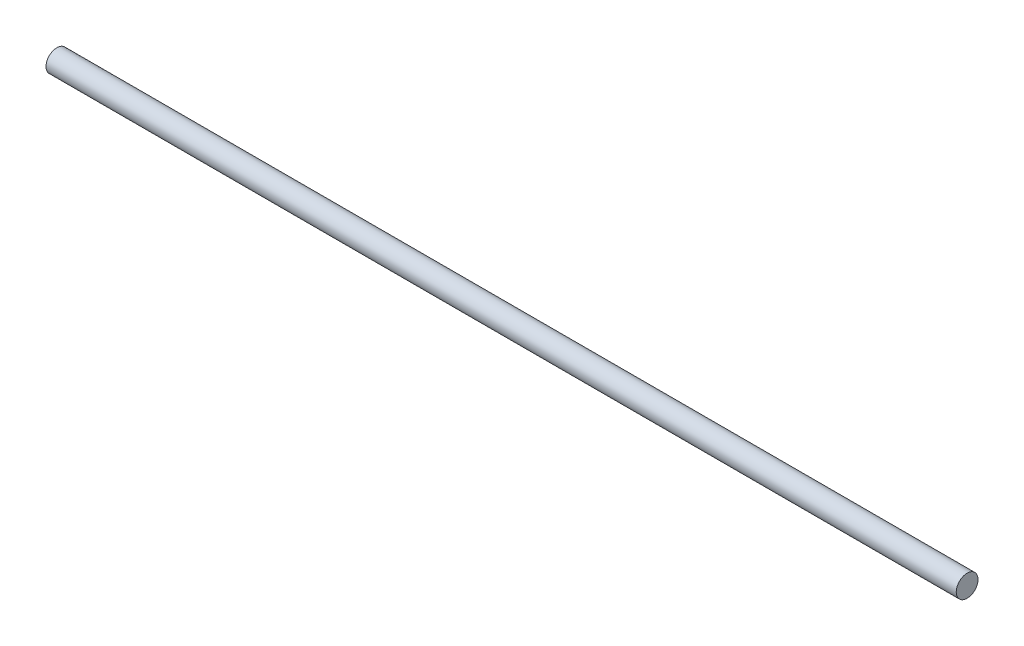
from build123d import *

# Parameters (mm, degrees)
SKETCH1_R           = 4
BOSS_EXTRUDE1_DEPTH = 334


with BuildPart() as part:
    # Sketch1 → Boss-Extrude1 (new body)
    with BuildSketch(Plane(origin=(0, 0, 0), x_dir=(0, 0, -1), z_dir=(1, 0, 0))):
        Circle(SKETCH1_R)
    extrude(amount=BOSS_EXTRUDE1_DEPTH)


solid = part.part
